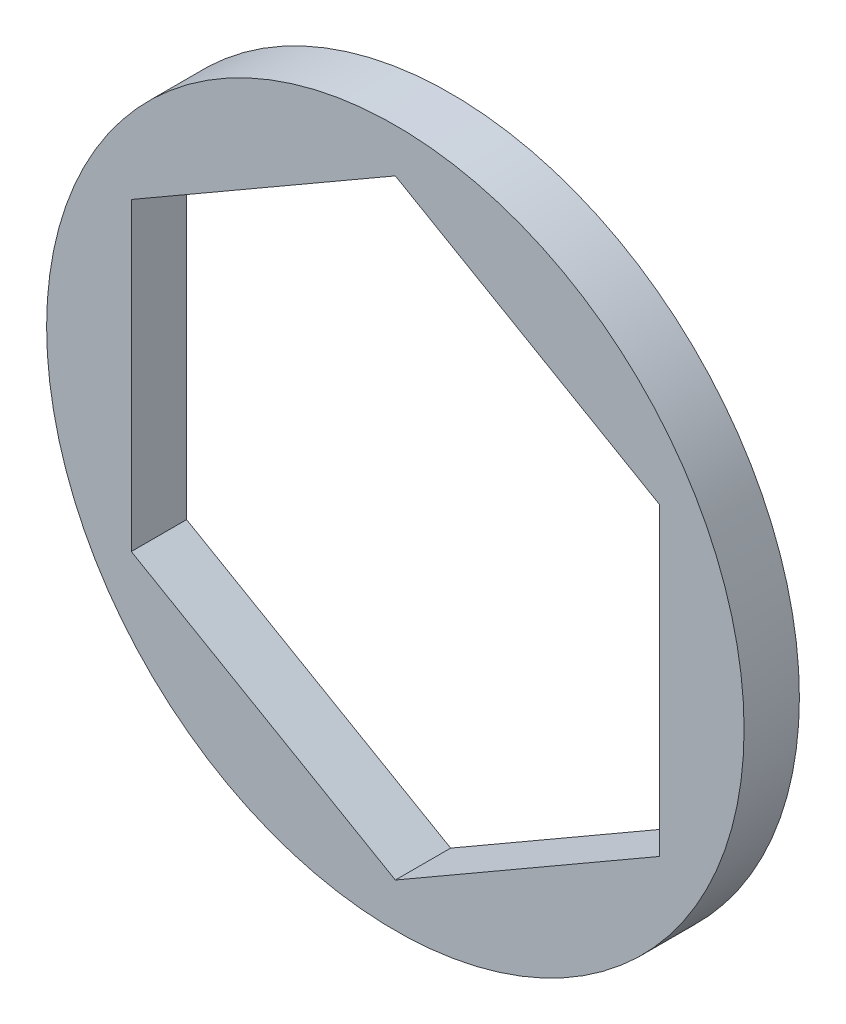
from build123d import *

# Parameters (mm, degrees)
SKETCH1_R           = 8.89
BOSS_EXTRUDE1_DEPTH = 1.4097


with BuildPart() as part:
    # Sketch1 → Boss-Extrude1 (new body)
    with BuildSketch(Plane.XY):
        Circle(SKETCH1_R)
        Polygon((6.731, 3.886144662), (0, 7.772289324), (-6.731, 3.886144662), (-6.731, -3.886144662), (0, -7.772289324), (6.731, -3.886144662), align=None, mode=Mode.SUBTRACT)
    extrude(amount=BOSS_EXTRUDE1_DEPTH)


solid = part.part
